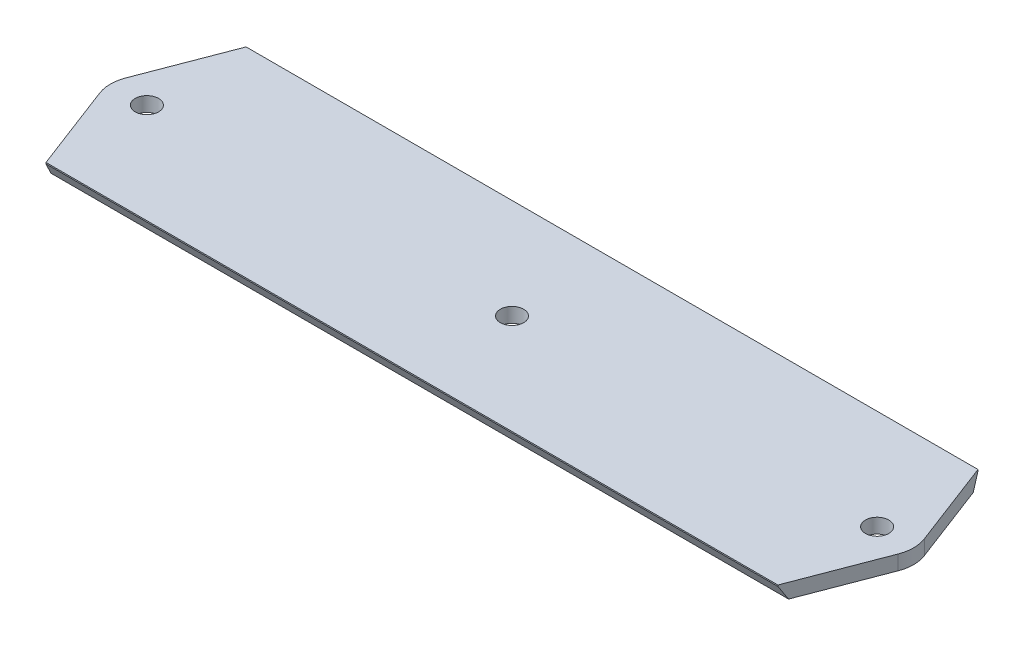
from build123d import *

# Parameters (mm, degrees)
SKETCH_1_R          = 1.6
EXTRUDE_1_DEPTH     = 2
CUT_EXTRUDE_1_DEPTH = 111.905365064
CHAMFER_1_SIZE      = 0.2
CHAMFER_1_SIZE2     = 0.1
CHAMFER_2_SIZE2     = 0.2
CHAMFER_2_SIZE      = 0.1


with BuildPart() as part:
    # Эскиз1 → Бобышка-Вытянуть1 (new body)
    with BuildSketch(Plane(origin=(0, 0, 0), x_dir=(1, 0, 0), z_dir=(0, 1, 0))):
        with BuildLine():
            Line((-75, 14), (-79.670248868, 1.785714286))
            ThreePointArc((-79.670248868, 1.785714286), (-80, 0), (-79.670248868, -1.785714286))
            Line((-79.670248868, -1.785714286), (-75, -14))
            Line((-75, -14), (25, -14))
            Line((25, -14), (29.670248868, -1.785714286))
            ThreePointArc((29.670248868, -1.785714286), (30, 0), (29.670248868, 1.785714286))
            Line((29.670248868, 1.785714286), (25, 14))
            Line((25, 14), (-75, 14))
        make_face()
        with Locations(Location((-75, 0, 0), (0, 0, 270))):
            Circle(SKETCH_1_R, mode=Mode.SUBTRACT)
        with Locations(Location((-25, 0, 0), (0, 0, 270))):
            Circle(SKETCH_1_R, mode=Mode.SUBTRACT)
        with Locations(Location((25, 0, 0), (0, 0, 270))):
            Circle(SKETCH_1_R, mode=Mode.SUBTRACT)
    extrude(amount=EXTRUDE_1_DEPTH)

    # Эскиз3 → Вырез-Вытянуть1 (cut, through all)
    with BuildSketch(Plane.ZY.offset(80)):
        Polygon((-13.8, 2), (-12.645299462, 0), (-14, 0), (-14, 2), align=None)
        Polygon((13.8, 2), (12.645299462, 0), (14, 0), (14, 2), align=None)
    extrude(amount=-CUT_EXTRUDE_1_DEPTH, mode=Mode.SUBTRACT)

    # Фаска1
    chamfer_1_edges = [part.edges().sort_by_distance(p)[0] for p in [
        (-25, 2, -13.8),
    ]]
    chamfer_1_side = [part.faces().sort_by_distance(p)[0] for p in [
        (-25, 0.998536994, -13.221805064),
    ]]
    chamfer(chamfer_1_edges, length=CHAMFER_1_SIZE, length2=CHAMFER_1_SIZE2, reference=chamfer_1_side[0])

    # Фаска2
    chamfer_2_edges = [part.edges().sort_by_distance(p)[0] for p in [
        (-25, 2, 13.8),
    ]]
    chamfer_2_side = [part.faces().sort_by_distance(p)[0] for p in [
        (-25, 2, 13.798),
    ]]
    chamfer(chamfer_2_edges, length=CHAMFER_2_SIZE - 0.0001, length2=CHAMFER_2_SIZE2 - 0.0001, reference=chamfer_2_side[0])  # a hair under: the kernel refuses the full size


solid = part.part
